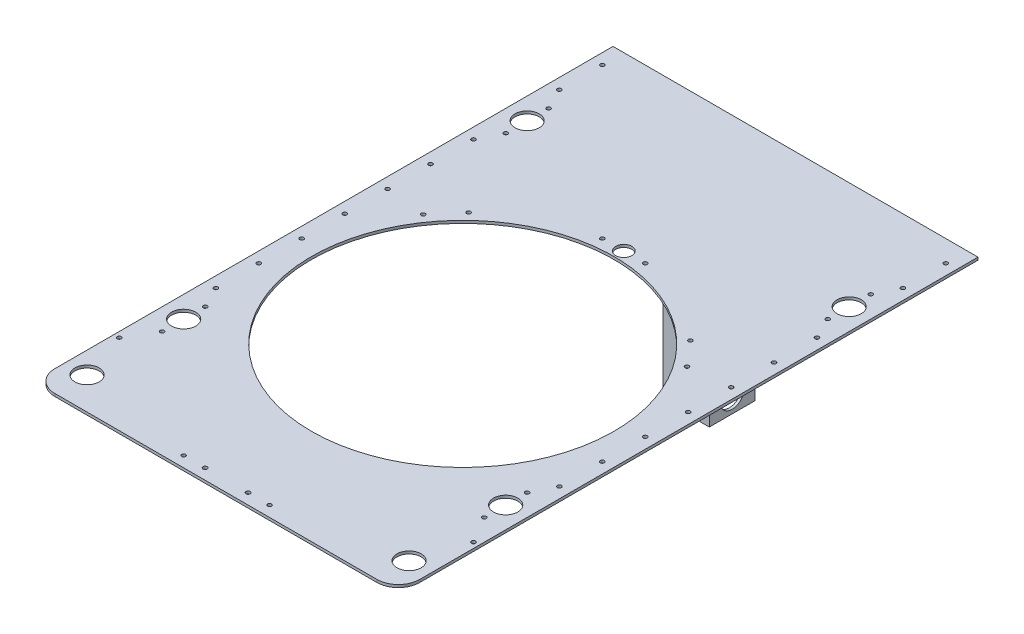
from build123d import *

# Parameters (mm, degrees)
SKETCH1_W           = 431.8
SKETCH1_H           = 685.8
BOSS_EXTRUDE1_DEPTH = 3.175
SKETCH2_R           = 14.3129
SKETCH2_R_2         = 2.38125
CUT_EXTRUDE1_DEPTH  = 406.22006444
SKETCH3_W           = 54.61
SKETCH3_H           = 53.975
BOSS_EXTRUDE2_DEPTH = 203.2
FILLET1_R           = 20.32
SKETCH4_W           = 48.26
SKETCH4_H           = 47.625
CUT_EXTRUDE2_DEPTH  = 203.2
SKETCH5_R           = 14.2875
CUT_EXTRUDE3_DEPTH  = 203.2
SKETCH6_R           = 179.07
CUT_EXTRUDE4_DEPTH  = 455.734934467
SKETCH8_R           = 9.525
SKETCH8_R_2         = 2.38125
CUT_EXTRUDE6_DEPTH  = 455.734934467
FILLET2_R           = 25.4
SKETCH10_R          = 14.3129
SKETCH10_R_2        = 2.38125
CUT_EXTRUDE8_DEPTH  = 455.734934467
SKETCH11_R          = 2.38125
CUT_EXTRUDE9_DEPTH  = 455.734934467
SKETCH13_R          = 2.38125
SKETCH13_R_2        = 2.466421692
SKETCH13_R_3        = 2.307769972
CUT_EXTRUDE10_DEPTH = 455.734934467
SKETCH14_R          = 2.38125
CUT_EXTRUDE11_DEPTH = 455.734934467


with BuildPart() as part:
    # Sketch1 → Boss-Extrude1 (new body)
    with BuildSketch(Plane(origin=(0, 0, 0), x_dir=(1, 0, 0), z_dir=(0, 1, 0))):
        Rectangle(SKETCH1_W, SKETCH1_H)
    extrude(amount=BOSS_EXTRUDE1_DEPTH)

    # Sketch2 → Cut-Extrude1 (cut, through all)
    with BuildSketch(Plane(origin=(0, 3.175, 0), x_dir=(1, 0, 0), z_dir=(0, 1, 0))):
        with Locations((-190.5, -304.8)):
            Circle(SKETCH2_R)
        with Locations((-190.5, -190.5)):
            Circle(SKETCH2_R)
        with Locations((190.5, -304.8)):
            Circle(SKETCH2_R)
        with Locations((190.5, -190.5)):
            Circle(SKETCH2_R)
        with Locations((190.5, -215.9)):
            Circle(SKETCH2_R_2)
        with Locations((190.5, -165.1)):
            Circle(SKETCH2_R_2)
        with Locations((-190.5, -215.9)):
            Circle(SKETCH2_R_2)
        with Locations((-190.5, -165.1)):
            Circle(SKETCH2_R_2)
    extrude(amount=-CUT_EXTRUDE1_DEPTH, mode=Mode.SUBTRACT)

    # Sketch3 → Boss-Extrude2 (add)
    with BuildSketch(Plane(origin=(0, 0, 0), x_dir=(-1, 0, 0), z_dir=(0, -1, 0))):
        with Locations((2.565647285, 243.220856884)):
            Rectangle(SKETCH3_W, SKETCH3_H)
    extrude(amount=BOSS_EXTRUDE2_DEPTH)

    # Fillet1
    fillet1_edges = [part.edges().sort_by_distance(p)[0] for p in [
        (24.739352715, 0, -243.220856884),
        (-2.565647285, 0, -270.208356884),
        (-2.565647285, 0, -216.233356884),
        (-29.870647285, 0, -243.220856884),
    ]]
    fillet(fillet1_edges, radius=FILLET1_R)

    # Sketch4 → Cut-Extrude2 (cut)
    with BuildSketch(Plane(origin=(0, -203.2, 0), x_dir=(-1, 0, 0), z_dir=(0, -1, 0))):
        with Locations((2.565647285, 243.220856884)):
            Rectangle(SKETCH4_W, SKETCH4_H)
    extrude(amount=-CUT_EXTRUDE2_DEPTH, mode=Mode.SUBTRACT)

    # Sketch5 → Cut-Extrude3 (cut)
    with BuildSketch(Plane.ZY.offset(29.870647285)):
        with Locations((-243.220856884, -184.15)):
            Circle(SKETCH5_R)
    extrude(amount=-CUT_EXTRUDE3_DEPTH, mode=Mode.SUBTRACT)

    # Sketch6 → Cut-Extrude4 (cut, through all)
    with BuildSketch(Plane(origin=(0, 3.175, 0), x_dir=(1, 0, 0), z_dir=(0, 1, 0))):
        with Locations((0, -50.8)):
            Circle(SKETCH6_R)
    extrude(amount=-CUT_EXTRUDE4_DEPTH, mode=Mode.SUBTRACT)

    # Sketch8 → Cut-Extrude6 (cut, through all)
    with BuildSketch(Plane(origin=(0, 3.175, 0), x_dir=(1, 0, 0), z_dir=(0, 1, 0))):
        with Locations((0, 139.7)):
            Circle(SKETCH8_R)
        with Locations((25.4, 139.7)):
            Circle(SKETCH8_R_2)
        with Locations((-25.4, 139.7)):
            Circle(SKETCH8_R_2)
    extrude(amount=-CUT_EXTRUDE6_DEPTH, mode=Mode.SUBTRACT)

    # Fillet2
    fillet2_edges = [part.edges().sort_by_distance(p)[0] for p in [
        (215.9, 1.5875, 342.9),
        (-215.9, 1.5875, 342.9),
    ]]
    fillet(fillet2_edges, radius=FILLET2_R)

    # Sketch10 → Cut-Extrude8 (cut, through all)
    with BuildSketch(Plane(origin=(0, 3.175, 0), x_dir=(1, 0, 0), z_dir=(0, 1, 0))):
        with Locations((-190.5, 215.9)):
            Circle(SKETCH10_R)
        with Locations((190.5, 215.9)):
            Circle(SKETCH10_R)
        with Locations((190.5, 190.5)):
            Circle(SKETCH10_R_2)
        with Locations((190.5, 241.3)):
            Circle(SKETCH10_R_2)
        with Locations((-190.5, 190.5)):
            Circle(SKETCH10_R_2)
        with Locations((-190.5, 241.3)):
            Circle(SKETCH10_R_2)
    extrude(amount=-CUT_EXTRUDE8_DEPTH, mode=Mode.SUBTRACT)

    # Sketch11 → Cut-Extrude9 (cut, through all)
    with BuildSketch(Plane(origin=(0, 3.175, 0), x_dir=(1, 0, 0), z_dir=(0, 1, 0))):
        with Locations((156.048464437, 58.466311125)):
            Circle(SKETCH11_R)
        with Locations((131.183773775, 87.334237241)):
            Circle(SKETCH11_R)
        with Locations((-131.183773775, 87.334237241)):
            Circle(SKETCH11_R)
        with Locations((-156.048464437, 58.466311125)):
            Circle(SKETCH11_R)
    extrude(amount=-CUT_EXTRUDE9_DEPTH, mode=Mode.SUBTRACT)

    # Sketch13 → Cut-Extrude10 (cut, through all)
    with BuildSketch(Plane(origin=(0, 3.175, 0), x_dir=(1, 0, 0), z_dir=(0, 1, 0))):
        with Locations((-203.2, 317.5)):
            Circle(SKETCH13_R)
        with Locations((-203.2, 266.7)):
            Circle(SKETCH13_R)
        with Locations((-203.2, 165.1)):
            Circle(SKETCH13_R)
        with Locations((-203.2, 114.3)):
            Circle(SKETCH13_R)
        with Locations((-203.2, 63.5)):
            Circle(SKETCH13_R)
        with Locations((-203.2, 12.7)):
            Circle(SKETCH13_R)
        with Locations((-203.2, -38.1)):
            Circle(SKETCH13_R)
        with Locations((-203.2, -88.9)):
            Circle(SKETCH13_R)
        with Locations((-203.2, -139.7)):
            Circle(SKETCH13_R)
        with Locations((203.2, -139.7)):
            Circle(SKETCH13_R)
        with Locations((203.2, 12.7)):
            Circle(SKETCH13_R)
        with Locations((203.2, 63.5)):
            Circle(SKETCH13_R)
        with Locations((203.2, 114.3)):
            Circle(SKETCH13_R)
        with Locations((203.2, 165.1)):
            Circle(SKETCH13_R)
        with Locations((203.2, 266.7)):
            Circle(SKETCH13_R)
        with Locations((203.2, 317.5)):
            Circle(SKETCH13_R)
        with Locations((-25.4, -330.2)):
            Circle(SKETCH13_R_2)
        with Locations((-50.8, -330.2)):
            Circle(SKETCH13_R_3)
        with Locations((50.8, -330.2)):
            Circle(SKETCH13_R_3)
        with Locations((25.4, -330.2)):
            Circle(SKETCH13_R_2)
        with Locations((203.2, -88.9)):
            Circle(SKETCH13_R)
        with Locations((203.2, -38.1)):
            Circle(SKETCH13_R)
    extrude(amount=-CUT_EXTRUDE10_DEPTH, mode=Mode.SUBTRACT)

    # Sketch14 → Cut-Extrude11 (cut, through all)
    with BuildSketch(Plane(origin=(0, 3.175, 0), x_dir=(1, 0, 0), z_dir=(0, 1, 0))):
        with Locations((209.55, -247.65)):
            Circle(SKETCH14_R)
        with Locations((-209.55, -247.65)):
            Circle(SKETCH14_R)
    extrude(amount=-CUT_EXTRUDE11_DEPTH, mode=Mode.SUBTRACT)


solid = part.part
